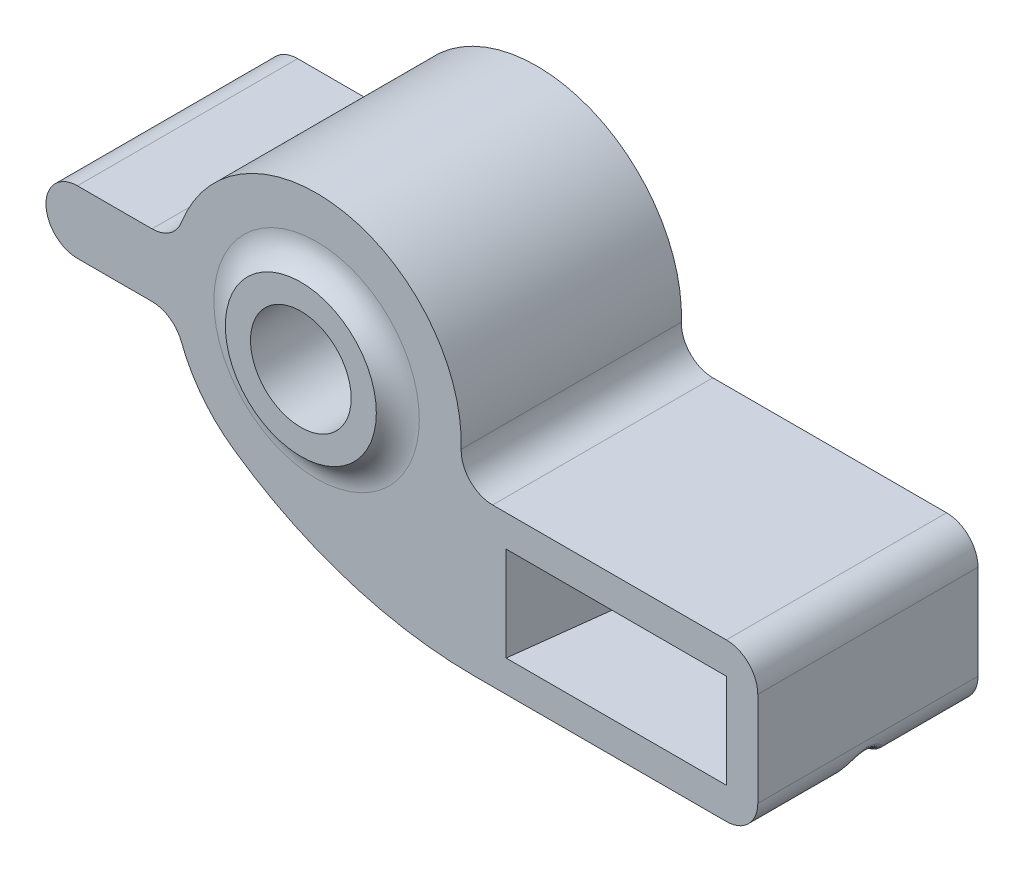
from build123d import *

# Parameters (mm, degrees)
SKETCH1_R           = 4.6
SKETCH1_R_2         = 1.6
BOSS_EXTRUDE1_DEPTH = 3.499999985
SKETCH2_W           = 7
SKETCH2_H           = 3
BOSS_EXTRUDE2_DEPTH = 3.499999985
BOSS_EXTRUDE3_REACH = 19.457
FILLET5_R           = 1
SKETCH6_R           = 0.625
CUT_EXTRUDE1_DEPTH  = 20.935540653
FILLET1_R           = 0.2
BOSS_EXTRUDE4_DEPTH = 3.499999985
FILLET2_R           = 1
FILLET3_R           = 1
BOSS_EXTRUDE5_START = 3.5
SKETCH1_2_R         = 4.6
SKETCH1_2_R_2       = 1.6
BOSS_EXTRUDE5_DEPTH = 0.5
SKETCH9_OUTSIDE_W   = 29.857
SKETCH9_OUTSIDE_H   = 18.02
SKETCH9_OUTSIDE_R   = 2.4
CUT_EXTRUDE2_DEPTH  = 0.5
FILLET4_R           = 1


with BuildPart() as part:
    # Sketch1 → Boss-Extrude1 (new, symmetric)
    with BuildSketch(Plane.XY):
        Circle(SKETCH1_R)
        Circle(SKETCH1_R_2, mode=Mode.SUBTRACT)
    extrude(amount=BOSS_EXTRUDE1_DEPTH, both=True)

    # Sketch2 → Boss-Extrude2 (add, symmetric)
    with BuildSketch(Plane.XY):
        with BuildLine():
            Line((14.025, -6.1875), (5.025, -6.1875))
            ThreePointArc((5.025, -6.1875), (1.004374029, -5.567503073), (-2.642710133, -3.765113963))
            ThreePointArc((-2.642710133, -3.765113963), (2.053101866, -4.116402887), (4.597420853, -0.154017857))
            ThreePointArc((4.597420853, -0.154017857), (4.878013126, -0.882668274), (5.596860169, -1.1875))
            Line((5.596860169, -1.1875), (14.025, -1.1875))
            Line((14.025, -1.1875), (14.025, -6.1875))
        make_face()
        with Locations((9.525, -3.6875)):
            Rectangle(SKETCH2_W, SKETCH2_H, mode=Mode.SUBTRACT)
    extrude(amount=BOSS_EXTRUDE2_DEPTH, both=True)

    # Sketch3 → Boss-Extrude3 (add, up to next)
    with BuildSketch(Plane(origin=(0, -5.1875, 0), x_dir=(1, 0, 0), z_dir=(0, 1, 0)), mode=Mode.PRIVATE) as boss_extrude3_sk1:
        with BuildLine():
            Line((6.497484118, 0.369658741), (6.025, -3.499999985))
            Line((6.025, -3.499999985), (6.025, 3.499999985))
            Line((6.025, 3.499999985), (8.025, 3.499999985))
            Line((8.025, 3.499999985), (8.025, 2.655654345))
            ThreePointArc((8.025, 2.655654345), (6.989049687, 1.694537108), (6.497484118, 0.369658741))
        make_face()
    boss_extrude3_tool1 = extrude(boss_extrude3_sk1.sketch, amount=BOSS_EXTRUDE3_REACH, mode=Mode.PRIVATE) - part.part
    # Sketch3 → Boss-Extrude3 (add, up to next)
    with BuildSketch(Plane(origin=(0, -5.1875, 0), x_dir=(1, 0, 0), z_dir=(0, 1, 0)), mode=Mode.PRIVATE) as boss_extrude3_sk2:
        with BuildLine():
            Line((12.552515882, 0.369658741), (13.025, -3.499999985))
            Line((13.025, -3.499999985), (13.025, 3.499999985))
            Line((13.025, 3.499999985), (11.025, 3.499999985))
            Line((11.025, 3.499999985), (11.025, 2.655654345))
            ThreePointArc((11.025, 2.655654345), (12.060950313, 1.694537108), (12.552515882, 0.369658741))
        make_face()
    boss_extrude3_tool2 = extrude(boss_extrude3_sk2.sketch, amount=BOSS_EXTRUDE3_REACH, mode=Mode.PRIVATE) - part.part
    add(boss_extrude3_tool1.solids().sort_by_distance((6.671602, -5.1875, -1.728299))[0])
    add(boss_extrude3_tool2.solids().sort_by_distance((12.378398, -5.1875, -1.728299))[0])

    # Fillet5
    fillet5_edges = [part.edges().sort_by_distance(p)[0] for p in [
        (14.025, -6.1875, 0),
        (14.025, -1.1875, 0),
    ]]
    fillet(fillet5_edges, radius=FILLET5_R)

    # Sketch6 → Cut-Extrude1 (cut, through all)
    with BuildSketch(Plane(origin=(14.025, 0, 0), x_dir=(0, 0, -1), z_dir=(1, 0, 0))):
        with Locations((0, -6.1875)):
            Circle(SKETCH6_R)
    extrude(amount=-CUT_EXTRUDE1_DEPTH, mode=Mode.SUBTRACT)

    # Fillet1
    fillet1_edges = [part.edges().sort_by_distance(p)[0] for p in [
        (13.95202478, -5.562500075, 0.000306186),
        (9.025, -6.1875, -0.625),
        (0.988571933, -5.562500075, 0.000306187),
        (9.025, -6.1875, 0.625),
    ]]
    fillet(fillet1_edges, radius=FILLET1_R)

    # Sketch7 → Boss-Extrude4 (add, symmetric)
    with BuildSketch(Plane.XY):
        with BuildLine():
            Line((-4.6, -1), (-7.6, -1))
            ThreePointArc((-7.6, -1), (-8.6, 0), (-7.6, 1))
            Line((-7.6, 1), (-4.6, 1))
            ThreePointArc((-4.6, 1), (-3.6, 0), (-4.6, -1))
        make_face()
    extrude(amount=BOSS_EXTRUDE4_DEPTH, both=True)

    # Fillet2
    fillet2_edges = [part.edges().sort_by_distance(p)[0] for p in [
        (-4.491304348, 0.994075075, 0),
        (-4.491304348, -0.994075075, 0),
    ]]
    fillet(fillet2_edges, radius=FILLET2_R)

    # Fillet3
    fillet3_edges = [part.edges().sort_by_distance(p)[0] for p in [
        (11.025, -3.6875, -2.655654345),
        (8.025, -3.6875, -2.655654345),
    ]]
    fillet(fillet3_edges, radius=FILLET3_R)

    # Sketch1<2> → Boss-Extrude5 (add, symmetric)
    with BuildSketch(Plane.XY.offset(BOSS_EXTRUDE5_START)):
        with Locations(Location((0, 0, 0), (0, 0, 159.075167572))):
            Circle(SKETCH1_2_R)
        Circle(SKETCH1_2_R_2, mode=Mode.SUBTRACT)
    extrude(amount=BOSS_EXTRUDE5_DEPTH, both=True)

    # Sketch9 outside → Cut-Extrude2 (cut)
    with BuildSketch(Plane.XY.offset(3.999999985)):
        with Locations((2.7125, -0.794)):
            Rectangle(SKETCH9_OUTSIDE_W, SKETCH9_OUTSIDE_H)
        Circle(SKETCH9_OUTSIDE_R, mode=Mode.SUBTRACT)
    extrude(amount=-CUT_EXTRUDE2_DEPTH, mode=Mode.SUBTRACT)

    # Fillet4
    # the kernel refuses this fillet: 1 mm, written as the material it adds along each edge
    with BuildSketch(Plane(origin=(0, 0, 3.499999985), x_dir=(1, 0, 0), z_dir=(0, -1, 0))) as fillet4_piece_1:
        with BuildLine():
            CenterArc((3.266025404, 1), FILLET4_R, 210, 60)
            Line((2.4, 0.5), (2.382679492, 0.49))
            ThreePointArc((2.382679492, 0.49), (2.38, 0.25), (2.38, 0))
            Line((2.38, 0), (2.4, -0.02))
            Line((2.4, -0.02), (3.266025404, -0.02))
            Line((3.266025404, -0.02), (3.266025404, 0))
        make_face()
    revolve(axis=Axis((0, 0, 3.499999985), (0, 0, 1)))


solid = part.part
